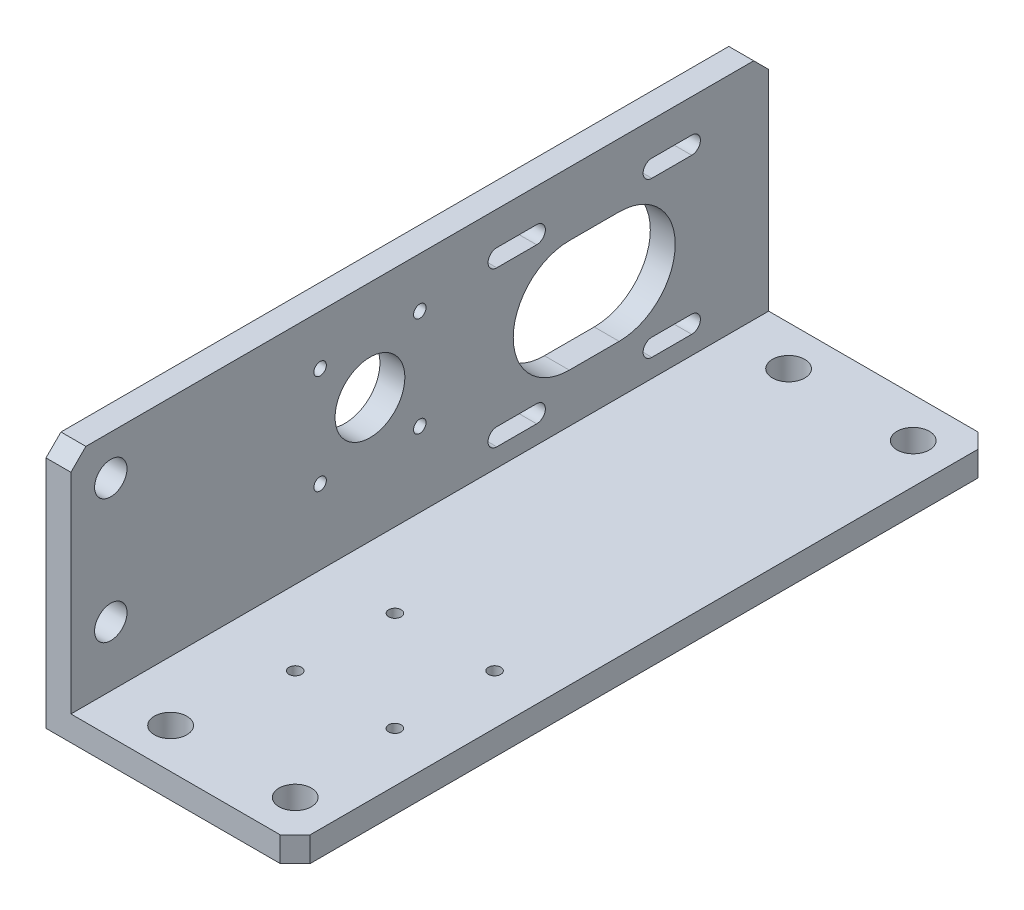
from build123d import *

# Parameters (mm, degrees)
ESTRUSIONE_ESTRUSIONE1_DEPTH = 140
FORO_6_5_6_5_1_D             = 6.5
FORO_6_5_6_5_2_D             = 6.5
FORO_6_5_6_5_2_DEPTH         = 5
FORO_6_5_6_5_2_TIP           = 1.952797012
TAGLIO_ESTRUSIONE3_REACH     = 158.844
SCHIZZO10_R                  = 7
TAGLIO_ESTRUSIONE6_REACH     = 158.844
SMUSSO1_SIZE                 = 3
M3_TAPPED_HOLE1_D            = 2.5
M3_TAPPED_HOLE2_D            = 2.5


with BuildPart() as part:
    # Schizzo1 → Estrusione-Estrusione1 (new body)
    with BuildSketch(Plane.XY):
        Polygon((0, 0), (0, 50), (5, 50), (5, 5), (50, 5), (50, 0), align=None)
    extrude(amount=ESTRUSIONE_ESTRUSIONE1_DEPTH)

    # Foro Ø6.5 (6.5)-1 (through all)
    with Locations(Plane(origin=(0, 0, 0), x_dir=(-1, 0, 0), z_dir=(0, -1, 0))):
        with Locations((-17, -132), (-42, -132)):
            foro_6_5_6_5_1 = Hole(FORO_6_5_6_5_1_D / 2)

    # Foro Ø6.5 (6.5)-2
    with Locations(Plane.ZY):
        with Locations((132, 42), (132, 17)):
            Hole(FORO_6_5_6_5_2_D / 2, depth=FORO_6_5_6_5_2_DEPTH)
            with Locations((0, 0, -(FORO_6_5_6_5_2_DEPTH + FORO_6_5_6_5_2_TIP / 2))):  # 118° drill point
                Cone(0, FORO_6_5_6_5_2_D / 2, FORO_6_5_6_5_2_TIP, mode=Mode.SUBTRACT)

    # Specchia1: Foro Ø6.5 (6.5)-1 across plane
    add(foro_6_5_6_5_1.mirror(Plane.XY.offset(70)), mode=Mode.SUBTRACT)

    # Schizzo10 → Taglio-Estrusione3 (cut, up to next)
    with BuildSketch(Plane.ZY, mode=Mode.PRIVATE) as taglio_estrusione3_sk1:
        with Locations((80, 30)):
            Circle(SCHIZZO10_R)
    taglio_estrusione3_tool1 = extrude(taglio_estrusione3_sk1.sketch, amount=-TAGLIO_ESTRUSIONE3_REACH, mode=Mode.PRIVATE) & part.part
    add(taglio_estrusione3_tool1.solids().sort_by_distance((0, 30, 80))[0], mode=Mode.SUBTRACT)

    # Schizzo13 → Taglio-Estrusione6 (cut, up to next)
    with BuildSketch(Plane.ZY, mode=Mode.PRIVATE) as taglio_estrusione6_sk1:
        with BuildLine():
            Line((15.443650814, 43.306349186), (23.443650814, 43.306349186))
            ThreePointArc((23.443650814, 43.306349186), (25.193650814, 41.556349186), (23.443650814, 39.806349186))
            Line((23.443650814, 39.806349186), (15.443650814, 39.806349186))
            ThreePointArc((15.443650814, 39.806349186), (13.693650814, 41.556349186), (15.443650814, 43.306349186))
        make_face()
    taglio_estrusione6_tool1 = extrude(taglio_estrusione6_sk1.sketch, amount=-TAGLIO_ESTRUSIONE6_REACH, mode=Mode.PRIVATE) & part.part
    # Schizzo13 → Taglio-Estrusione6 (cut, up to next)
    with BuildSketch(Plane.ZY, mode=Mode.PRIVATE) as taglio_estrusione6_sk2:
        with BuildLine():
            Line((15.443650814, 8.693650814), (23.443650814, 8.693650814))
            ThreePointArc((23.443650814, 8.693650814), (25.193650814, 10.443650814), (23.443650814, 12.193650814))
            Line((23.443650814, 12.193650814), (15.443650814, 12.193650814))
            ThreePointArc((15.443650814, 12.193650814), (13.693650814, 10.443650814), (15.443650814, 8.693650814))
        make_face()
    taglio_estrusione6_tool2 = extrude(taglio_estrusione6_sk2.sketch, amount=-TAGLIO_ESTRUSIONE6_REACH, mode=Mode.PRIVATE) & part.part
    # Schizzo13 → Taglio-Estrusione6 (cut, up to next)
    with BuildSketch(Plane.ZY, mode=Mode.PRIVATE) as taglio_estrusione6_sk3:
        with BuildLine():
            Line((54.556349186, 43.306349186), (46.556349186, 43.306349186))
            ThreePointArc((46.556349186, 43.306349186), (44.806349186, 41.556349186), (46.556349186, 39.806349186))
            Line((46.556349186, 39.806349186), (54.556349186, 39.806349186))
            ThreePointArc((54.556349186, 39.806349186), (56.306349186, 41.556349186), (54.556349186, 43.306349186))
        make_face()
    taglio_estrusione6_tool3 = extrude(taglio_estrusione6_sk3.sketch, amount=-TAGLIO_ESTRUSIONE6_REACH, mode=Mode.PRIVATE) & part.part
    # Schizzo13 → Taglio-Estrusione6 (cut, up to next)
    with BuildSketch(Plane.ZY, mode=Mode.PRIVATE) as taglio_estrusione6_sk4:
        with BuildLine():
            Line((54.556349186, 8.693650814), (46.556349186, 8.693650814))
            ThreePointArc((46.556349186, 8.693650814), (44.806349186, 10.443650814), (46.556349186, 12.193650814))
            Line((46.556349186, 12.193650814), (54.556349186, 12.193650814))
            ThreePointArc((54.556349186, 12.193650814), (56.306349186, 10.443650814), (54.556349186, 8.693650814))
        make_face()
    taglio_estrusione6_tool4 = extrude(taglio_estrusione6_sk4.sketch, amount=-TAGLIO_ESTRUSIONE6_REACH, mode=Mode.PRIVATE) & part.part
    # Schizzo13 → Taglio-Estrusione6 (cut, up to next)
    with BuildSketch(Plane.ZY, mode=Mode.PRIVATE) as taglio_estrusione6_sk5:
        with BuildLine():
            Line((40, 14.75), (30, 14.75))
            ThreePointArc((30, 14.75), (18.75, 26), (30, 37.25))
            Line((30, 37.25), (40, 37.25))
            ThreePointArc((40, 37.25), (51.25, 26), (40, 14.75))
        make_face()
    taglio_estrusione6_tool5 = extrude(taglio_estrusione6_sk5.sketch, amount=-TAGLIO_ESTRUSIONE6_REACH, mode=Mode.PRIVATE) & part.part
    add(taglio_estrusione6_tool1.solids().sort_by_distance((0, 41.556349, 19.443651))[0], mode=Mode.SUBTRACT)
    add(taglio_estrusione6_tool2.solids().sort_by_distance((0, 10.443651, 19.443651))[0], mode=Mode.SUBTRACT)
    add(taglio_estrusione6_tool3.solids().sort_by_distance((0, 41.556349, 50.556349))[0], mode=Mode.SUBTRACT)
    add(taglio_estrusione6_tool4.solids().sort_by_distance((0, 10.443651, 50.556349))[0], mode=Mode.SUBTRACT)
    add(taglio_estrusione6_tool5.solids().sort_by_distance((0, 26, 35))[0], mode=Mode.SUBTRACT)

    # Smusso1
    smusso1_edges = [part.edges().sort_by_distance(p)[0] for p in [
        (50, 2.5, 0),
        (2.5, 50, 0),
        (50, 2.5, 140),
        (2.5, 50, 140),
    ]]
    chamfer(smusso1_edges, length=SMUSSO1_SIZE)

    # M3 Tapped Hole1 (through all)
    with Locations(Plane(origin=(0, 40, 70), x_dir=(0, 0, -1), z_dir=(-1, 0, 0))):
        with Locations((0, 0), (-20, 0), (-20, 20), (0, 20)):
            Hole(M3_TAPPED_HOLE1_D / 2)

    # M3 Tapped Hole2 (through all)
    with Locations(Plane(origin=(20, 0, 110), x_dir=(-1, 0, 0), z_dir=(0, -1, 0))):
        with Locations((0, 0), (-20, 0), (-20, 20), (0, 20)):
            Hole(M3_TAPPED_HOLE2_D / 2)


solid = part.part
